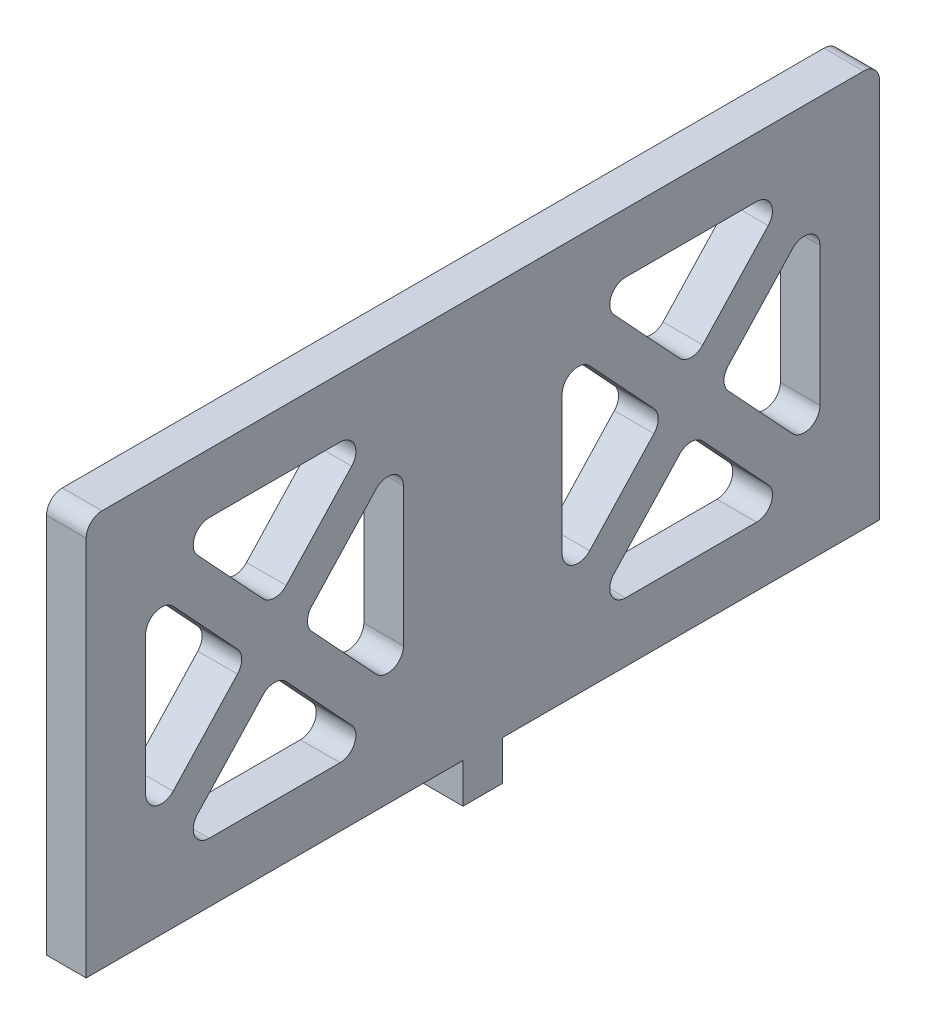
from build123d import *

# Parameters (mm, degrees)
BOSS_EXTRUDE1_DEPTH = 6.35
CUT_EXTRUDE1_DEPTH  = 97.772416654
FILLET1_R           = 2.54
FILLET2_R           = 2.54


with BuildPart() as part:
    # Sketch4 → Boss-Extrude1 (new body)
    with BuildSketch(Plane(origin=(0, 0, 0), x_dir=(0, 0, -1), z_dir=(1, 0, 0))):
        Polygon((0, 6.35), (-60.325, 6.35), (-60.325, 69.85), (66.675, 69.85), (66.675, 6.35), (6.35, 6.35), (6.35, 0), (0, 0), align=None)
    extrude(amount=BOSS_EXTRUDE1_DEPTH)

    # Sketch5 → Cut-Extrude1 (cut, through all)
    with BuildSketch(Plane(origin=(6.35, 0, 0), x_dir=(0, 0, -1), z_dir=(1, 0, 0))):
        Polygon((-13.857734988, 60.325), (-46.467265012, 60.325), (-30.1625, 42.766022295), align=None)
        Polygon((-34.495234988, 38.1), (-50.8, 55.658977705), (-50.8, 20.541022295), align=None)
        Polygon((-9.525, 55.658977705), (-25.829765012, 38.1), (-9.525, 20.541022295), align=None)
        Polygon((-13.857734988, 15.875), (-30.1625, 33.433977705), (-46.467265012, 15.875), align=None)
        Polygon((52.817265012, 60.325), (20.207734988, 60.325), (36.5125, 42.766022295), align=None)
        Polygon((32.179765012, 38.1), (15.875, 55.658977705), (15.875, 20.541022295), align=None)
        Polygon((57.15, 55.658977705), (40.845234988, 38.1), (57.15, 20.541022295), align=None)
        Polygon((52.817265012, 15.875), (36.5125, 33.433977705), (20.207734988, 15.875), align=None)
    extrude(amount=-CUT_EXTRUDE1_DEPTH, mode=Mode.SUBTRACT)

    # Fillet1
    fillet1_edges = [part.edges().sort_by_distance(p)[0] for p in [
        (3.175, 33.433977705, 30.1625),
        (3.175, 15.875, 13.857734988),
        (3.175, 15.875, 46.467265012),
        (3.175, 55.658977705, 9.525),
        (3.175, 20.541022295, 9.525),
        (3.175, 38.1, 25.829765012),
        (3.175, 33.433977705, -36.5125),
        (3.175, 15.875, -52.817265012),
        (3.175, 15.875, -20.207734988),
        (3.175, 38.1, -40.845234988),
        (3.175, 55.658977705, -57.15),
        (3.175, 20.541022295, -57.15),
        (3.175, 38.1, 34.495234988),
        (3.175, 20.541022295, 50.8),
        (3.175, 55.658977705, 50.8),
        (3.175, 60.325, -20.207734988),
        (3.175, 60.325, -52.817265012),
        (3.175, 42.766022295, -36.5125),
        (3.175, 60.325, 13.857734988),
        (3.175, 42.766022295, 30.1625),
        (3.175, 55.658977705, -15.875),
        (3.175, 38.1, -32.179765012),
        (3.175, 20.541022295, -15.875),
        (3.175, 60.325, 46.467265012),
    ]]
    fillet(fillet1_edges, radius=FILLET1_R)

    # Fillet2
    fillet2_edges = [part.edges().sort_by_distance(p)[0] for p in [
        (3.175, 69.85, -66.675),
        (3.175, 69.85, 60.325),
    ]]
    fillet(fillet2_edges, radius=FILLET2_R)


solid = part.part
